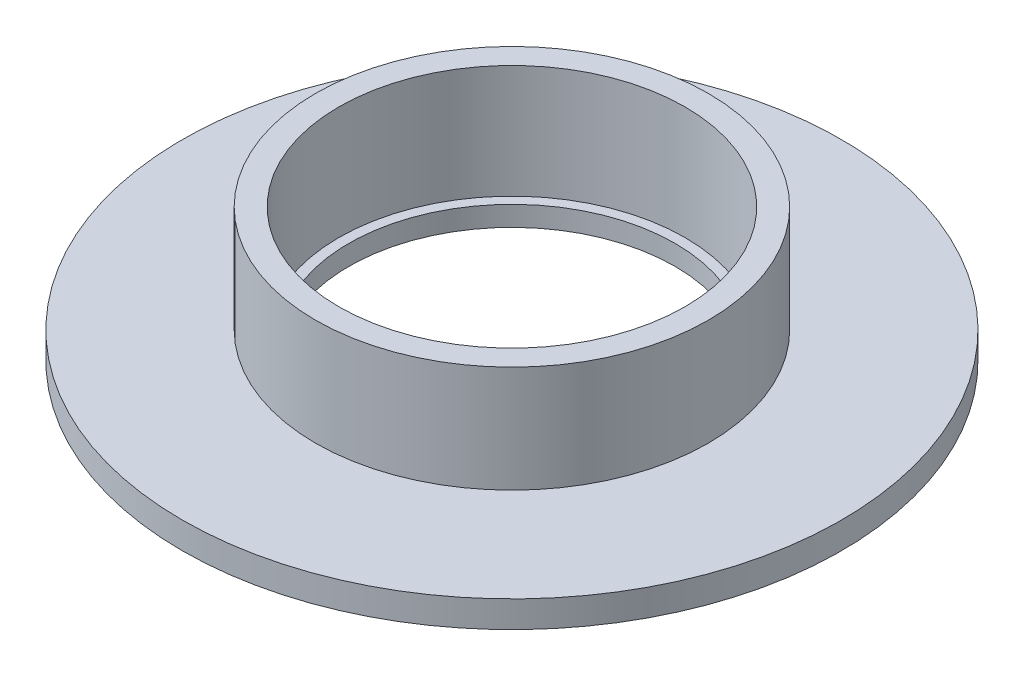
from build123d import *

# Parameters (mm, degrees)
SKETCH_1_R      = 49.5
SKETCH_1_R_2    = 24.5
EXTRUDE_2_DEPTH = 3
SKETCH_2_R      = 49.5
SKETCH_2_R_2    = 26
EXTRUDE_3_DEPTH = 1
SKETCH_3_R      = 29.5
SKETCH_3_R_2    = 26
EXTRUDE_4_DEPTH = 16


with BuildPart() as part:
    # Эскиз1 → Бобышка-Вытянуть2 (new body)
    with BuildSketch(Plane(origin=(0, 0, 0), x_dir=(1, 0, 0), z_dir=(0, 1, 0))):
        Circle(SKETCH_1_R)
        Circle(SKETCH_1_R_2, mode=Mode.SUBTRACT)
    extrude(amount=EXTRUDE_2_DEPTH)

    # Эскиз2 → Бобышка-Вытянуть3 (add)
    with BuildSketch(Plane(origin=(0, 3, 0), x_dir=(1, 0, 0), z_dir=(0, 1, 0))):
        Circle(SKETCH_2_R)
        Circle(SKETCH_2_R_2, mode=Mode.SUBTRACT)
    extrude(amount=EXTRUDE_3_DEPTH)

    # Эскиз3 → Бобышка-Вытянуть4 (add)
    with BuildSketch(Plane(origin=(0, 4, 0), x_dir=(1, 0, 0), z_dir=(0, 1, 0))):
        Circle(SKETCH_3_R)
        Circle(SKETCH_3_R_2, mode=Mode.SUBTRACT)
    extrude(amount=EXTRUDE_4_DEPTH)


solid = part.part
